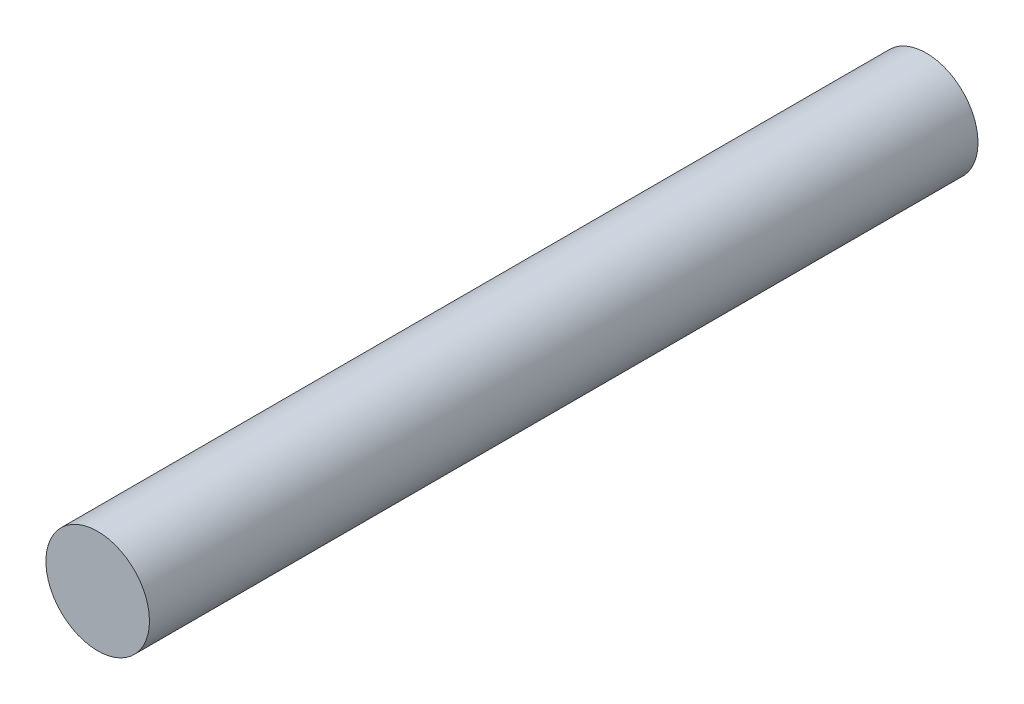
from build123d import *

# Parameters (mm, degrees)
BOSS_EXTRUDE1_DEPTH      = 50.8
BOSS_EXTRUDE1_DEPTH_BACK = 50.8
SKETCH1_R                = 6.35


with BuildPart() as part:
    # Sketch1 → Boss-Extrude1 (new, two sides: drawn at the far end of the back side and taken through both)
    with BuildSketch(Plane.XY.offset(-BOSS_EXTRUDE1_DEPTH_BACK)):
        Circle(SKETCH1_R)
    extrude(amount=BOSS_EXTRUDE1_DEPTH + BOSS_EXTRUDE1_DEPTH_BACK)


solid = part.part
